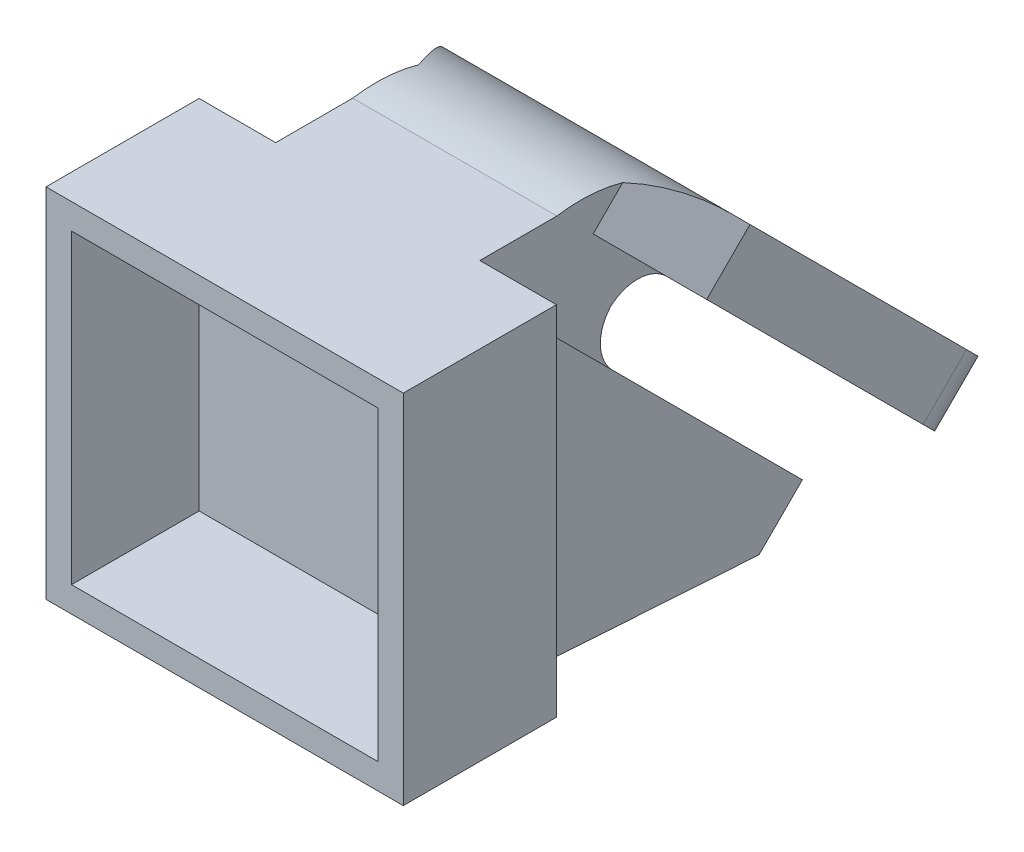
from build123d import *

# Parameters (mm, degrees)
SCHIZZO1_W                   = 70
SCHIZZO1_H                   = 70
SCHIZZO1_W_2                 = 60
SCHIZZO1_H_2                 = 60
ESTRUSIONE_ESTRUSIONE1_DEPTH = 30
SCHIZZO2_W                   = 70
SCHIZZO2_H                   = 70
ESTRUSIONE_ESTRUSIONE2_DEPTH = 5
SCHIZZO3_W                   = 40
SCHIZZO3_H                   = 20
ESTRUSIONE_ESTRUSIONE3_DEPTH = 25
SMUSSO1_SIZE                 = 20
SCHIZZO4_W                   = 60
SCHIZZO4_H                   = 12
SCHIZZO4_W_2                 = 40
ESTRUSIONE_ESTRUSIONE4_DEPTH = 80
SCHIZZO19_W                  = 60
SCHIZZO19_H                  = 12
ESTRUSIONE_ESTRUSIONE7_DEPTH = 10
TAGLIO_ESTRUSIONE1_START     = 3
SCHIZZO6_R                   = 27.575
TAGLIO_ESTRUSIONE1_DEPTH     = 9
TAGLIO_ESTRUSIONE2_REACH     = 105.555
SCHIZZO7_R                   = 23.7
SCHIZZO9_R                   = 11.1
TAGLIO_ESTRUSIONE3_DEPTH     = 2.5
TAGLIO_ESTRUSIONE4_REACH     = 108.384
SCHIZZO10_R                  = 1.5
SCHIZZO11_R                  = 2.8
TAGLIO_ESTRUSIONE5_DEPTH     = 3.2
TAGLIO_ESTRUSIONE6_REACH     = 107.837
SCHIZZO12_R                  = 5
SCHIZZO13_W                  = 40
SCHIZZO13_H                  = 54
ESTRUSIONE_ESTRUSIONE5_DEPTH = 7
SCHIZZO17_W                  = 40
SCHIZZO17_H                  = 45
ESTRUSIONE_ESTRUSIONE6_DEPTH = 15
RACCORDO4_R                  = 10
SCHIZZO18_W                  = 60
SCHIZZO18_H                  = 60
TAGLIO_ESTRUSIONE10_DEPTH    = 114.024428621
SMUSSO2_SIZE                 = 20
SMUSSO2_SIZE_2               = 11.547005384
RACCORDO5_R                  = 30
RACCORDO6_R                  = 8
RACCORDO7_R                  = 15
ESTRUSIONE_ESTRUSIONE8_START = 20
ESTRUSIONE_ESTRUSIONE8_DEPTH = 4
ESTRUSIONE_ESTRUSIONE9_START = -20
ESTRUSIONE_ESTRUSIONE9_DEPTH = 4


# Some blends are built 0.0001 mm under size
with BuildPart() as part:
    # Schizzo1 → Estrusione-Estrusione1 (new body)
    with BuildSketch(Plane.XY):
        Rectangle(SCHIZZO1_W, SCHIZZO1_H)
        Rectangle(SCHIZZO1_W_2, SCHIZZO1_H_2, mode=Mode.SUBTRACT)
    extrude(amount=ESTRUSIONE_ESTRUSIONE1_DEPTH)

    # Schizzo2 → Estrusione-Estrusione2 (add)
    with BuildSketch(Plane.XY):
        Rectangle(SCHIZZO2_W, SCHIZZO2_H)
    extrude(amount=ESTRUSIONE_ESTRUSIONE2_DEPTH)

    # Schizzo3 → Estrusione-Estrusione3 (add)
    with BuildSketch(Plane(origin=(0, 0, 0), x_dir=(-1, 0, 0), z_dir=(0, 0, -1))):
        with Locations((0, 25)):
            Rectangle(SCHIZZO3_W, SCHIZZO3_H)
    extrude(amount=ESTRUSIONE_ESTRUSIONE3_DEPTH)

    # Smusso1
    smusso1_edges = [part.edges().sort_by_distance(p)[0] for p in [
        (0, 15, -25),
    ]]
    chamfer(smusso1_edges, length=SMUSSO1_SIZE - 0.0001)  # a hair under: the kernel refuses the full size

    # Schizzo4 → Estrusione-Estrusione4 (add)
    with BuildSketch(Plane(origin=(0, 5, 5), x_dir=(-1, 0, 0), z_dir=(0, -0.7071067811865487, -0.7071067811865464))):
        with Locations((0, 41.784271247)):
            Rectangle(SCHIZZO4_W, SCHIZZO4_H)
        with Locations((0, 14.784271247)):
            Rectangle(SCHIZZO4_W_2, SCHIZZO4_H)
    extrude(amount=ESTRUSIONE_ESTRUSIONE4_DEPTH)

    # Schizzo19 → Estrusione-Estrusione7 (add)
    with BuildSketch(Plane(origin=(0, -51.568542495, -51.568542495), x_dir=(1, 0, 0), z_dir=(0, -0.7071067811865488, -0.7071067811865464))):
        with Locations((0, -41.784271247)):
            Rectangle(SCHIZZO19_W, SCHIZZO19_H)
    extrude(amount=ESTRUSIONE_ESTRUSIONE7_DEPTH)

    # Schizzo6 → Taglio-Estrusione1 (cut)
    with BuildSketch(Plane(origin=(0, 25.303300859, -25.303300859), x_dir=(1, 0, 0), z_dir=(0, 0.7071067811865465, -0.7071067811865486)).offset(TAGLIO_ESTRUSIONE1_START)):
        with Locations(Location((0, 52.928932188, 0), (0, 0, 90))):
            Circle(SCHIZZO6_R)
    extrude(amount=TAGLIO_ESTRUSIONE1_DEPTH, mode=Mode.SUBTRACT)

    # Schizzo7 → Taglio-Estrusione2 (cut, up to next)
    with BuildSketch(Plane(origin=(0, 25.303300859, -25.303300859), x_dir=(1, 0, 0), z_dir=(0, 0.7071067811865464, -0.7071067811865487)), mode=Mode.PRIVATE) as taglio_estrusione2_sk1:
        with Locations(Location((0, 52.928932188, 0), (0, 0, 270))):
            Circle(SCHIZZO7_R)
    taglio_estrusione2_tool1 = extrude(taglio_estrusione2_sk1.sketch, amount=TAGLIO_ESTRUSIONE2_REACH, mode=Mode.PRIVATE) & part.part
    add(taglio_estrusione2_tool1.solids().sort_by_distance((0, -12.123106, -62.729708))[0], mode=Mode.SUBTRACT)

    # Schizzo9 → Taglio-Estrusione3 (cut)
    with BuildSketch(Plane(origin=(0, 6.211417767, -6.211417767), x_dir=(1, 0, 0), z_dir=(0, -0.7071067811865464, 0.7071067811865487))):
        with Locations(Location((0, -52.928932188, 0), (0, 0, 270))):
            Circle(SCHIZZO9_R)
    extrude(amount=-TAGLIO_ESTRUSIONE3_DEPTH, mode=Mode.SUBTRACT)

    # Schizzo10 → Taglio-Estrusione4 (cut, up to next)
    with BuildSketch(Plane(origin=(0, 6.211417767, -6.211417767), x_dir=(1, 0, 0), z_dir=(0, -0.7071067811865464, 0.7071067811865487)), mode=Mode.PRIVATE) as taglio_estrusione4_sk1:
        with Locations(Location((-9.89414905, -43.02409425, 0), (0, 0, 270))):
            Circle(SCHIZZO10_R)
    taglio_estrusione4_tool1 = extrude(taglio_estrusione4_sk1.sketch, amount=-TAGLIO_ESTRUSIONE4_REACH, mode=Mode.PRIVATE) & part.part
    # Schizzo10 → Taglio-Estrusione4 (cut, up to next)
    with BuildSketch(Plane(origin=(0, 6.211417767, -6.211417767), x_dir=(1, 0, 0), z_dir=(0, -0.7071067811865464, 0.7071067811865487)), mode=Mode.PRIVATE) as taglio_estrusione4_sk2:
        with Locations(Location((9.89414905, -43.02409425, 0), (0, 0, 270))):
            Circle(SCHIZZO10_R)
    taglio_estrusione4_tool2 = extrude(taglio_estrusione4_sk2.sketch, amount=-TAGLIO_ESTRUSIONE4_REACH, mode=Mode.PRIVATE) & part.part
    # Schizzo10 → Taglio-Estrusione4 (cut, up to next)
    with BuildSketch(Plane(origin=(0, 6.211417767, -6.211417767), x_dir=(1, 0, 0), z_dir=(0, -0.7071067811865464, 0.7071067811865487)), mode=Mode.PRIVATE) as taglio_estrusione4_sk3:
        with Locations(Location((9.89414905, -62.833770126, 0), (0, 0, 270))):
            Circle(SCHIZZO10_R)
    taglio_estrusione4_tool3 = extrude(taglio_estrusione4_sk3.sketch, amount=-TAGLIO_ESTRUSIONE4_REACH, mode=Mode.PRIVATE) & part.part
    # Schizzo10 → Taglio-Estrusione4 (cut, up to next)
    with BuildSketch(Plane(origin=(0, 6.211417767, -6.211417767), x_dir=(1, 0, 0), z_dir=(0, -0.7071067811865464, 0.7071067811865487)), mode=Mode.PRIVATE) as taglio_estrusione4_sk4:
        with Locations(Location((-9.89414905, -62.833770126, 0), (0, 0, 270))):
            Circle(SCHIZZO10_R)
    taglio_estrusione4_tool4 = extrude(taglio_estrusione4_sk4.sketch, amount=-TAGLIO_ESTRUSIONE4_REACH, mode=Mode.PRIVATE) & part.part
    add(taglio_estrusione4_tool1.solids().sort_by_distance((-9.894149, -24.211211, -36.634047))[0], mode=Mode.SUBTRACT)
    add(taglio_estrusione4_tool2.solids().sort_by_distance((9.894149, -24.211211, -36.634047))[0], mode=Mode.SUBTRACT)
    add(taglio_estrusione4_tool3.solids().sort_by_distance((9.894149, -38.218767, -50.641603))[0], mode=Mode.SUBTRACT)
    add(taglio_estrusione4_tool4.solids().sort_by_distance((-9.894149, -38.218767, -50.641603))[0], mode=Mode.SUBTRACT)

    # Schizzo11 → Taglio-Estrusione5 (cut)
    with BuildSketch(Plane(origin=(0, 14.696699141, -14.696699141), x_dir=(1, 0, 0), z_dir=(0, 0.7071067811865464, -0.7071067811865487))):
        with Locations(Location((-9.89414905, 62.833770126, 0), (0, 0, 270))):
            Circle(SCHIZZO11_R)
        with Locations(Location((-9.89414905, 43.02409425, 0), (0, 0, 270))):
            Circle(SCHIZZO11_R)
        with Locations(Location((9.89414905, 62.833770126, 0), (0, 0, 270))):
            Circle(SCHIZZO11_R)
        with Locations(Location((9.89414905, 43.02409425, 0), (0, 0, 270))):
            Circle(SCHIZZO11_R)
    extrude(amount=-TAGLIO_ESTRUSIONE5_DEPTH, mode=Mode.SUBTRACT)

    # Schizzo12 → Taglio-Estrusione6 (cut, up to next)
    with BuildSketch(Plane(origin=(0, 7.97918472, -7.97918472), x_dir=(1, 0, 0), z_dir=(0, -0.7071067811865464, 0.7071067811865487)), mode=Mode.PRIVATE) as taglio_estrusione6_sk1:
        with Locations(Location((0, -52.928932188, 0), (0, 0, 270))):
            Circle(SCHIZZO12_R)
    taglio_estrusione6_tool1 = extrude(taglio_estrusione6_sk1.sketch, amount=-TAGLIO_ESTRUSIONE6_REACH, mode=Mode.PRIVATE) & part.part
    add(taglio_estrusione6_tool1.solids().sort_by_distance((0, -29.447222, -45.405592))[0], mode=Mode.SUBTRACT)

    # Schizzo13 → Estrusione-Estrusione5 (add)
    with BuildSketch(Plane(origin=(0, 5, 5), x_dir=(1, 0, 0), z_dir=(0, 0.7071067811865488, 0.7071067811865464))):
        with Locations((0, 20.784271247)):
            Rectangle(SCHIZZO13_W, SCHIZZO13_H)
    extrude(amount=ESTRUSIONE_ESTRUSIONE5_DEPTH)

    # Schizzo17 → Estrusione-Estrusione6 (add)
    with BuildSketch(Plane(origin=(0, 5, 5), x_dir=(1, 0, 0), z_dir=(0, -0.7071067811865487, -0.7071067811865465))):
        with Locations((0, -13.284271247)):
            Rectangle(SCHIZZO17_W, SCHIZZO17_H)
    extrude(amount=ESTRUSIONE_ESTRUSIONE6_DEPTH)

    # Raccordo4
    raccordo4_edges = [part.edges().sort_by_distance(p)[0] for p in [
        (20, -41.114484041, -62.022600949),
        (-20, -41.114484041, -62.022600949),
        (-30, -29.093668761, -88.185551853),
        (30, -29.093668761, -88.185551853),
    ]]
    fillet(raccordo4_edges, radius=RACCORDO4_R)

    # Schizzo18 → Taglio-Estrusione10 (cut, through all)
    with BuildSketch(Plane.XY.offset(5)):
        Rectangle(SCHIZZO18_W, SCHIZZO18_H)
    extrude(amount=TAGLIO_ESTRUSIONE10_DEPTH, mode=Mode.SUBTRACT)

    # Smusso2
    # the kernel refuses this chamfer: 20, 11.547005384 mm, written as the material it takes off along each edge
    with BuildSketch(Plane(origin=(-30, 75.375499846, -65.375499846), x_dir=(-0.019326765612700806, -0.7069747082219261, -0.7069747082219237), z_dir=(0, -0.7071067811865464, 0.7071067811865487))) as smusso2_piece_1_section:
        Polygon((SMUSSO2_SIZE * 0.999813220622, SMUSSO2_SIZE * 0.0193267656127), (-SMUSSO2_SIZE_2 * 0.0193267656124, SMUSSO2_SIZE_2 * 0.999813220604), (0, 0), align=None)
    smusso2_piece_1 = extrude(amount=63.741715093, mode=Mode.PRIVATE)
    smusso2_piece_1 = split(smusso2_piece_1, bisect_by=Plane(origin=(-20, 29.75727976, -29.334603333), z_dir=(-1, 0, 0)), keep=Keep.TOP, mode=Mode.PRIVATE)
    add(smusso2_piece_1, mode=Mode.SUBTRACT)
    with BuildSketch(Plane(origin=(30, 30.303300859, -20.303300859), x_dir=(-0.9983227437537926, 0.04093714269400887, 0.04093714269400999), z_dir=(0, 0.7071067811865464, -0.7071067811865487))) as smusso2_piece_2_section:
        Polygon((SMUSSO2_SIZE_2 * 0.998322743736, -SMUSSO2_SIZE_2 * 0.0578938624016), (-SMUSSO2_SIZE * 0.0578938624027, -SMUSSO2_SIZE * 0.998322743754), (0, 0), align=None)
    smusso2_piece_2 = extrude(amount=63.741715093, mode=Mode.PRIVATE)
    smusso2_piece_2 = split(smusso2_piece_2, bisect_by=Plane(origin=(20, 29.75727976, -29.334603333), z_dir=(1, 0, 0)), keep=Keep.TOP, mode=Mode.PRIVATE)
    add(smusso2_piece_2, mode=Mode.SUBTRACT)

    # Raccordo5
    # the kernel refuses this fillet: 30 mm, written as the material it takes off along each edge
    with BuildSketch(Plane(origin=(-80.660687982, 43.738329701, -23.838834765), x_dir=(0, -0.707106781186546, 0.7071067811865489), z_dir=(1, 0, 0))) as raccordo5_piece_1:
        with BuildLine():
            CenterArc((30, 24.264275193), RACCORDO5_R, 180, 53.979747048)
            Line((0, 24.264275193), (-0.6, 24.264275193))
            Line((-0.6, 24.264275193), (-0.6, 0))
            Line((-0.6, 0), (0, -0.6))
            ThreePointArc((0, -0.6), (6.178932188, -0.6), (12.005021664, -0.485285504))
            Line((12.005021664, -0.485285504), (12.357864376, 0))
        make_face()
    extrude(amount=161.321375964, mode=Mode.SUBTRACT)

    # Raccordo6
    # the kernel refuses this fillet: 8 mm, written as the material it adds along each edge
    with BuildSketch(Plane(origin=(-20, 9.090097423, -20.303300859), x_dir=(0, 0.7071067811865467, -0.7071067811865487), z_dir=(1, 0, 0))) as raccordo6_piece_1:
        with BuildLine():
            CenterArc((RACCORDO6_R, -RACCORDO6_R), RACCORDO6_R, 90, 90)
            Line((0, -RACCORDO6_R), (0, 0))
            Line((0, 0), (RACCORDO6_R, 0))
        make_face()
    extrude(amount=40)
    with BuildSketch(Plane(origin=(20, 19.696699141, -30.909902577), x_dir=(0, -0.7071067811865491, -0.707106781186546), z_dir=(-1, 0, 0))) as raccordo6_piece_2:
        with BuildLine():
            CenterArc((RACCORDO6_R, RACCORDO6_R), RACCORDO6_R, 180, 90)
            Line((0, RACCORDO6_R), (0, 0))
            Line((0, 0), (RACCORDO6_R, 0))
        make_face()
    extrude(amount=40)

    # Raccordo7
    # the kernel refuses this fillet: 15 mm, written as the material it adds along each edge
    with BuildSketch(Plane(origin=(-20, -11.213203436, 0), x_dir=(0, -1, 0), z_dir=(1, 0, 0))) as raccordo7_piece_1:
        with BuildLine():
            CenterArc((RACCORDO7_R * 0.414213562373, RACCORDO7_R), RACCORDO7_R, 225, 45)
            Line((-RACCORDO7_R * 0.292893218813, RACCORDO7_R * 0.292893218813), (0, 0))
            Line((0, 0), (RACCORDO7_R * 0.414213562373, 0))
        make_face()
    extrude(amount=40)
    with BuildSketch(Plane(origin=(20, 0.604816049, -11.818019485), x_dir=(0, -0.7071067811865464, 0.7071067811865487), z_dir=(-1, 0, 0))) as raccordo7_piece_2:
        with BuildLine():
            CenterArc((RACCORDO7_R, -RACCORDO7_R), RACCORDO7_R, 90, 90)
            Line((0, -RACCORDO7_R), (0, 0))
            Line((0, 0), (RACCORDO7_R, 0))
        make_face()
    extrude(amount=40)

    # Schizzo20 → Estrusione-Estrusione8 (add)
    with BuildSketch(Plane(origin=(0, 0, 0), x_dir=(0, 0, -1), z_dir=(1, 0, 0)).offset(ESTRUSIONE_ESTRUSIONE8_START)):
        Polygon((0, -35), (50.70889245, -38.286056916), (59.194173824, -29.800775542), (0, 29.393398282), align=None)
    extrude(amount=ESTRUSIONE_ESTRUSIONE8_DEPTH)

    # Schizzo21 → Estrusione-Estrusione9 (add)
    with BuildSketch(Plane(origin=(0, 0, 0), x_dir=(0, 0, -1), z_dir=(1, 0, 0)).offset(ESTRUSIONE_ESTRUSIONE9_START)):
        Polygon((50.70889245, -38.286056916), (0, -35), (0, 29.393398282), (59.194173824, -29.800775542), align=None)
    extrude(amount=-ESTRUSIONE_ESTRUSIONE9_DEPTH)


solid = part.part
